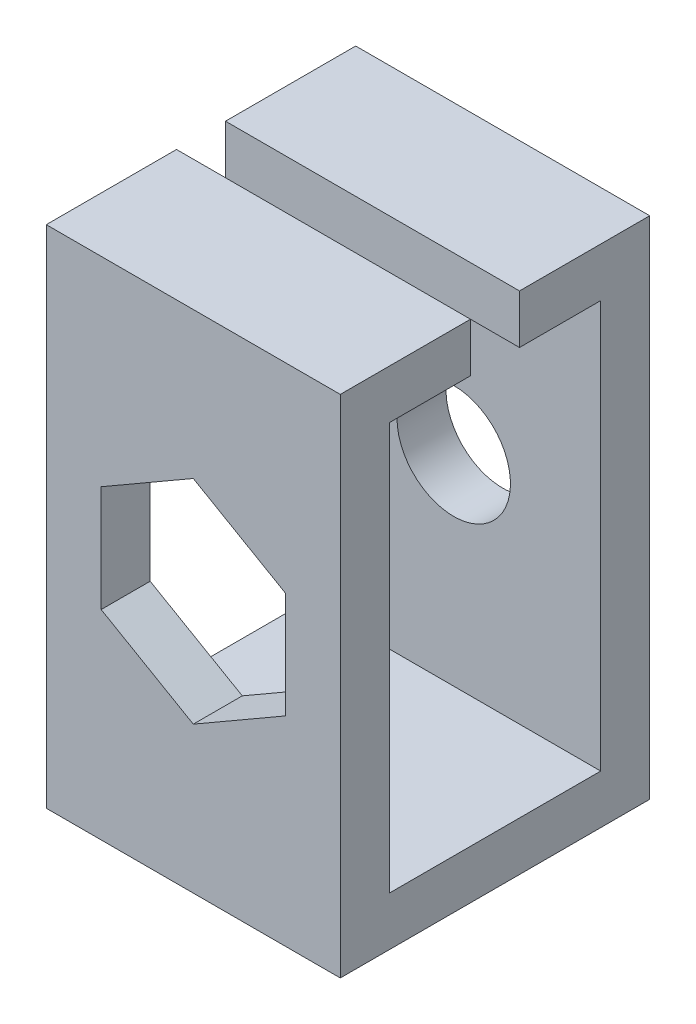
from build123d import *

# Parameters (mm, degrees)
TOP_START                      = -3.123265701
TOP_BAR_CUT_EXTRUDE1_OUTLINE_W = 203.2
TOP_BAR_CUT_EXTRUDE1_OUTLINE_H = 25.4
TOP_BAR_CUT_EXTRUDE1_DEPTH     = 12.7
TOP_START_2                    = 6.35
TOP_BAR_OUTLINE_W              = 203.2
TOP_BAR_OUTLINE_H              = 25.4
TOP_BAR_DEPTH                  = 3.226734299
TOP_BAR_2_DEPTH                = 9.473265701
TOP_START_3                    = -6.35
TOP_BAR_3_OUTLINE_W            = 203.2
TOP_BAR_3_OUTLINE_H            = 25.4
TOP_BAR_3_DEPTH                = 12.7
BOSS_EXTRUDE2_DEPTH            = 9.525
SKETCH4_R                      = 3.675
CUT_EXTRUDE1_DEPTH             = 28.583849441
CUT_EXTRUDE2_DEPTH             = 3.175


# Read off the part's stored shape, not the designer's step: <top bar>-<Cut-Extrude1>, top bar
with BuildPart() as part:
    # <top bar>-<Cut-Extrude1> outline → <top bar>-<Cut-Extrude1> (new body)
    with BuildSketch(Plane.XY.offset(TOP_START)):
        with Locations((-0.022421442, 2.056236138)):
            Rectangle(TOP_BAR_CUT_EXTRUDE1_OUTLINE_W, TOP_BAR_CUT_EXTRUDE1_OUTLINE_H)
        with BuildLine():
            ThreePointArc((-95.272421442, -1.618763862), (-98.947421442, 2.056236138), (-95.272421442, 5.731236138))
            Line((-95.272421442, 5.731236138), (6.327578558, 5.731236138))
            ThreePointArc((6.327578558, 5.731236138), (10.002578558, 2.056236138), (6.327578558, -1.618763862))
            Line((6.327578558, -1.618763862), (-95.272421442, -1.618763862))
        make_face(mode=Mode.SUBTRACT)
    extrude(amount=TOP_BAR_CUT_EXTRUDE1_DEPTH)

    # top bar outline → top bar (cut)
    with BuildSketch(Plane.XY.offset(TOP_START_2)):
        with Locations((-0.022421442, 2.056236138)):
            Rectangle(TOP_BAR_OUTLINE_W, TOP_BAR_OUTLINE_H)
        with BuildLine():
            ThreePointArc((6.327578558, 5.731236138), (10.002578558, 2.056236138), (6.327578558, -1.618763862))
            Line((6.327578558, -1.618763862), (-95.272421442, -1.618763862))
            ThreePointArc((-95.272421442, -1.618763862), (-98.947421442, 2.056236138), (-95.272421442, 5.731236138))
            Line((-95.272421442, 5.731236138), (6.327578558, 5.731236138))
        make_face(mode=Mode.SUBTRACT)
    extrude(amount=TOP_BAR_DEPTH, mode=Mode.SUBTRACT)

    # top bar 2 outline → top bar 2 (cut)
    with BuildSketch(Plane.XY.offset(TOP_START)):
        Polygon((-101.6, 12.7), (101.577578558, 12.7), (101.577578558, 14.756236138), (-101.622421442, 14.756236138), (-101.622421442, -10.643763862), (-101.6, -10.643763862), align=None)
        with BuildLine():
            ThreePointArc((-95.272421442, -1.618763862), (-97.461703705, -0.895486778), (-98.789240286, 0.989648017))
            ThreePointArc((-98.789240286, 0.989648017), (-98.177676678, -2.221336145), (-95.25, -3.675))
            Line((-95.25, -3.675), (6.35, -3.675))
            ThreePointArc((6.35, -3.675), (9.301722916, -2.189282263), (9.866818844, 1.066588121))
            ThreePointArc((9.866818844, 1.066588121), (8.548914703, -0.87144054), (6.327578558, -1.618763862))
            Line((6.327578558, -1.618763862), (-95.272421442, -1.618763862))
        make_face()
    extrude(amount=TOP_BAR_2_DEPTH, mode=Mode.SUBTRACT)

    # top bar 3 outline → top bar 3 (add)
    with BuildSketch(Plane.XY.offset(TOP_START_3)):
        Rectangle(TOP_BAR_3_OUTLINE_W, TOP_BAR_3_OUTLINE_H)
        with BuildLine():
            ThreePointArc((-95.25, -3.675), (-98.925, 0), (-95.25, 3.675))
            Line((-95.25, 3.675), (6.35, 3.675))
            ThreePointArc((6.35, 3.675), (10.025, 0), (6.35, -3.675))
            Line((6.35, -3.675), (-95.25, -3.675))
        make_face(mode=Mode.SUBTRACT)
    extrude(amount=TOP_BAR_3_DEPTH)


with BuildPart() as body_2:
    # Sketch3 → Boss-Extrude2 (new, symmetric)
    with BuildSketch(Plane(origin=(0, 0, 0), x_dir=(0, 0, -1), z_dir=(1, 0, 0))):
        Polygon((-1.5875, 13.2), (-1.5875, 16.375), (-10.025, 16.375), (-10.025, -16.375), (10.025, -16.375), (10.025, 16.375), (1.5875, 16.375), (1.5875, 13.2), (6.85, 13.2), (6.85, -13.2), (-6.85, -13.2), (-6.85, 13.2), align=None)
    extrude(amount=BOSS_EXTRUDE2_DEPTH, both=True)

    # Sketch4 → Cut-Extrude1 (cut, through all)
    with BuildSketch(Plane(origin=(0, 0, -10.025), x_dir=(-1, 0, 0), z_dir=(0, 0, -1))):
        with Locations(Location((0, 0, 0), (0, 0, 90))):
            Circle(SKETCH4_R)
    extrude(amount=-CUT_EXTRUDE1_DEPTH, mode=Mode.SUBTRACT)

    # Sketch5 → Cut-Extrude2 (cut)
    with BuildSketch(Plane.XY.offset(10.025)):
        Polygon((0, 6.892407514), (-5.969, 3.446203757), (-5.969, -3.446203757), (0, -6.892407514), (5.969, -3.446203757), (5.969, 3.446203757), align=None)
    extrude(amount=-CUT_EXTRUDE2_DEPTH, mode=Mode.SUBTRACT)


solid = body_2.part
